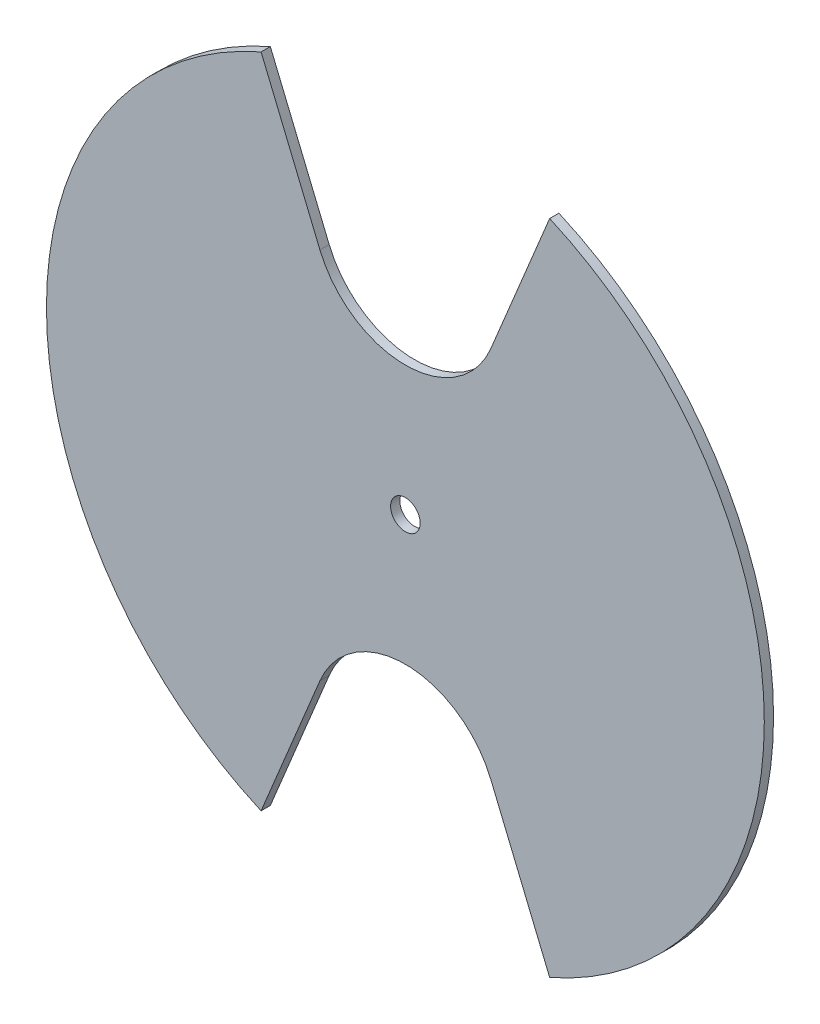
from build123d import *

# Parameters (mm, degrees)
ESQUISSE1_R             = 97
ESQUISSE1_R_2           = 4
BOSS_EXTRU_1_DEPTH      = 2.5
ENL_V_MAT_EXTRU_1_DEPTH = 138.201494161


with BuildPart() as part:
    # Esquisse1 → Boss.-Extru.1 (new body)
    with BuildSketch(Plane.XY):
        Circle(ESQUISSE1_R)
        Circle(ESQUISSE1_R_2, mode=Mode.SUBTRACT)
    extrude(amount=BOSS_EXTRU_1_DEPTH)

    # Esquisse2 → Enlèv. mat.-Extru.1 (cut, symmetric)
    with BuildSketch(Plane.XY.offset(2.5)):
        with BuildLine():
            Line((219.060870494, 523.531576288), (38.995875853, 88.816224117))
            Line((38.995875853, 88.816224117), (23.096988313, 50.432914191))
            ThreePointArc((23.096988313, 50.432914191), (0, 35), (-23.096988313, 50.432914191))
            Line((-23.096988313, 50.432914191), (-38.995875853, 88.816224117))
            Line((-38.995875853, 88.816224117), (-219.060870494, 523.531576288))
            Line((-219.060870494, 523.531576288), (-219.060870494, 1464.596589361))
            Line((-219.060870494, 1464.596589361), (219.060870494, 1464.596589361))
            Line((219.060870494, 1464.596589361), (219.060870494, 523.531576288))
        make_face()
    enl_v_mat_extru_1 = extrude(amount=ENL_V_MAT_EXTRU_1_DEPTH, both=True, mode=Mode.SUBTRACT)

    # Symétrie1: Enlèv. mat.-Extru.1 across plane
    add(enl_v_mat_extru_1.mirror(Plane.ZX), mode=Mode.SUBTRACT)


solid = part.part
